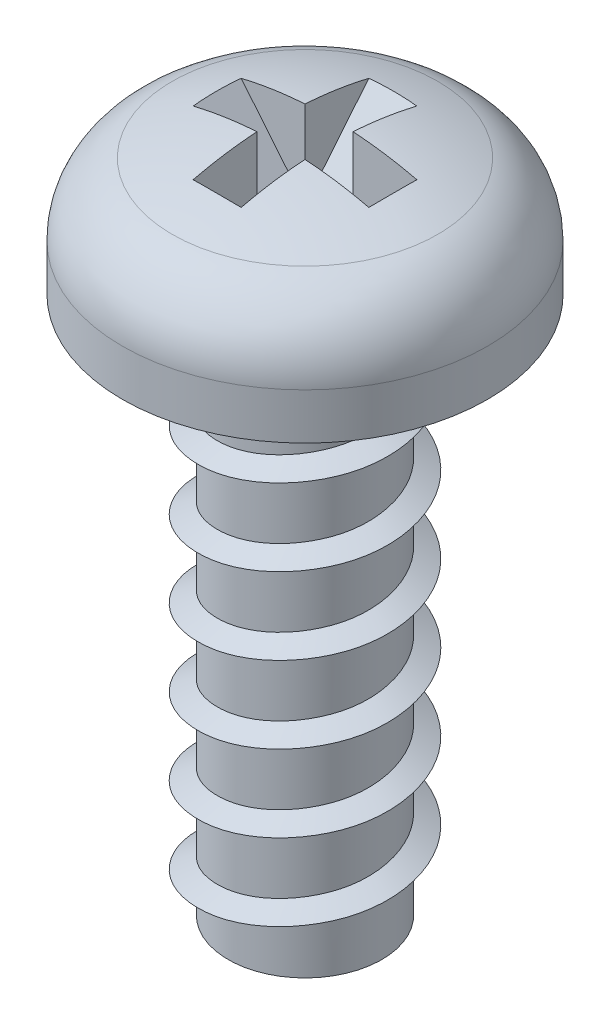
from build123d import *

# Parameters (mm, degrees)
ENL_V_MAT_EXTRU_1_DEPTH      = 0.625
R_P_TITION_CIRCULAIRE1_COUNT = 4
BALAYAGE2_PITCH              = 2.0000000000000027


with BuildPart() as part:
    # Esquisse1 → Révolution3 (revolve)
    with BuildSketch(Plane.XY, mode=Mode.PRIVATE) as r_volution3_sk:
        with BuildLine():
            Line((0, -13.999999999999998), (-3.5e-16, 3.7000000000000006))
            ThreePointArc((-3.5e-16, 3.7000000000000006), (1.7553133623373336, 3.5417234928553425), (3.4540000000000006, 3.0720000000000014))
            ThreePointArc((3.4540000000000006, 3.0720000000000014), (4.394384383287557, 2.3384199576606166), (4.75, 1.2000000000000002))
            Line((4.75, 1.2000000000000002), (4.75, -8.7e-16))
            Line((4.75, -8.7e-16), (2, 0))
            Line((2, 0), (2.0000000000000018, -14))
            Line((2.0000000000000018, -14), (0, -13.999999999999998))
        make_face()
    revolve(r_volution3_sk.sketch.rotate(Axis((0, 0, 0), (0, 1, 0)), 90), axis=Axis((0, 0, 0), (0, 1, 0)))

    # Esquisse2 → Enlèv. mat.-Extru.1 (cut, symmetric)
    with BuildSketch(Plane.XY):
        with BuildLine():
            Line((6e-16, 3.7), (3.1e-16, 1.2000000000000002))
            ThreePointArc((3.1e-16, 1.2000000000000002), (0.4276014607574767, 1.2960326384442458), (0.7730755285566453, 1.5656860184838555))
            Line((0.7730755285566453, 1.5656860184838555), (2.3000000000000003, 3.426638129307072))
            ThreePointArc((2.3000000000000003, 3.426638129307072), (1.158093984997412, 3.631419877129164), (6e-16, 3.7))
        make_face()
    enl_v_mat_extru_1 = extrude(amount=ENL_V_MAT_EXTRU_1_DEPTH, both=True, mode=Mode.SUBTRACT)

    # Répétition circulaire1: Enlèv. mat.-Extru.1 ×4 about axis
    r_p_tition_circulaire1_axis = Axis((0, 0, -1e-17), (0, 1, 0))
    for i in range(1, R_P_TITION_CIRCULAIRE1_COUNT):
        add(enl_v_mat_extru_1.rotate(r_p_tition_circulaire1_axis, i * 360 / R_P_TITION_CIRCULAIRE1_COUNT), mode=Mode.SUBTRACT)

    # Balayage2: the profile of Esquisse3 profile screwed along a right-hand helix of 7 turns, 6 arcs to a turn; built about Z, then put on its axis
    balayage2_z = Axis((0, 0, 0), (0, 0, 1))
    balayage2_corners = [(1.9997, 0, -0.000173205), (2.5, 0, 0.288675135), (1.9997, 0, 0.577523474)]
    with BuildLine(mode=Mode.PRIVATE) as balayage2_profile:
        Line(balayage2_corners[0], balayage2_corners[1])
        Line(balayage2_corners[1], balayage2_corners[2])
        Line(balayage2_corners[2], balayage2_corners[0])
    balayage2_cap = Face(balayage2_profile.wire())
    balayage2_turn_angles = [0, 30, 60, 90, 120, 150, 180, 210, 240, 270, 300, 330, 360]
    balayage2_turn_weights = [1, 0.8660254037844387, 1, 0.8660254037844387, 1, 0.8660254037844387, 1, 0.8660254037844387, 1, 0.8660254037844387, 1, 0.8660254037844387, 1]
    balayage2_turn_rails = [Edge.make_bspline([Vector(p[0], p[1], 0).rotate(balayage2_z, balayage2_turn_angles[k]) / balayage2_turn_weights[k] + Vector(0, 0, p[2] + BALAYAGE2_PITCH * balayage2_turn_angles[k] / 360) for k in range(13)], [0, 0, 0, 1, 1, 2, 2, 3, 3, 4, 4, 5, 5, 6, 6, 6], 2, balayage2_turn_weights) for p in balayage2_corners]
    balayage2_turn_sides = [Face.make_surface_from_curves(balayage2_turn_rails[p[0]], balayage2_turn_rails[p[1]]) for p in [(0, 1), (1, 2), (2, 0)]]
    balayage2 = Plane(origin=(0, -13.999999999999998, 0), x_dir=(0, 0, -1), z_dir=(0, 1, 0)) * Solid(Shell([*[p.moved(Location((0, 0, BALAYAGE2_PITCH * i))) for i in range(7) for p in balayage2_turn_sides], balayage2_cap, balayage2_cap.rotate(balayage2_z, 2520).moved(Location((0, 0, BALAYAGE2_PITCH * 2520 / 360)))]))
    add(balayage2)


solid = part.part
